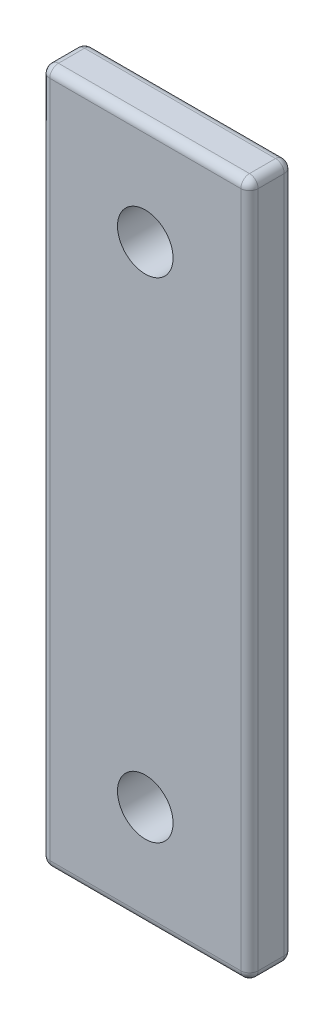
from build123d import *

# Parameters (mm, degrees)
SKETCH1_W           = 48
SKETCH1_H           = 160
BOSS_EXTRUDE1_DEPTH = 10
FILLET1_R           = 2
FILLET2_R           = 2
SKETCH2_R           = 6.4
CUT_EXTRUDE1_DEPTH  = 85.118963379


with BuildPart() as part:
    # Sketch1 → Boss-Extrude1 (new body)
    with BuildSketch(Plane.XY):
        Rectangle(SKETCH1_W, SKETCH1_H)
    extrude(amount=BOSS_EXTRUDE1_DEPTH)

    # Fillet1
    fillet1_edges = [part.edges().sort_by_distance(p)[0] for p in [
        (-24, 0, 10),
        (0, -80, 10),
        (24, 0, 10),
        (0, -80, 0),
        (-24, 0, 0),
        (0, 80, 0),
        (24, 0, 0),
        (0, 80, 10),
    ]]
    fillet(fillet1_edges, radius=FILLET1_R)

    # Fillet2
    # the kernel refuses this fillet: 2 mm, written as the material it takes off along each edge
    with BuildSketch(Plane(origin=(-22, 78, 8), x_dir=(0, 1, 0), z_dir=(-1, 0, 0))) as fillet2_piece_1_section:
        Polygon((0, 0), (FILLET2_R, 0), (FILLET2_R, -FILLET2_R), (0, -FILLET2_R), align=None)
    fillet2_piece_1 = extrude(amount=FILLET2_R, mode=Mode.PRIVATE)
    fillet2_piece_1 = fillet2_piece_1 - Plane(origin=(-22, 78, 8), x_dir=(0, -0.7071067811865475, -0.7071067811865475), z_dir=(-1, 0, 0)) * Sphere(FILLET2_R, mode=Mode.PRIVATE)
    add(fillet2_piece_1, mode=Mode.SUBTRACT)
    with BuildSketch(Plane(origin=(22, 78, 8), x_dir=(0, 1, 0), z_dir=(1, 0, 0))) as fillet2_piece_2_section:
        Polygon((0, 0), (FILLET2_R, 0), (FILLET2_R, FILLET2_R), (0, FILLET2_R), align=None)
    fillet2_piece_2 = extrude(amount=FILLET2_R, mode=Mode.PRIVATE)
    fillet2_piece_2 = fillet2_piece_2 - Plane(origin=(22, 78, 8), x_dir=(0, -0.7071067811865475, -0.7071067811865475), z_dir=(1, 0, 0)) * Sphere(FILLET2_R, mode=Mode.PRIVATE)
    add(fillet2_piece_2, mode=Mode.SUBTRACT)
    with BuildSketch(Plane(origin=(-22, -78, 8), x_dir=(-1, 0, 0), z_dir=(0, -1, 0))) as fillet2_piece_3_section:
        Polygon((0, 0), (FILLET2_R, 0), (FILLET2_R, -FILLET2_R), (0, -FILLET2_R), align=None)
    fillet2_piece_3 = extrude(amount=FILLET2_R, mode=Mode.PRIVATE)
    fillet2_piece_3 = fillet2_piece_3 - Plane(origin=(-22, -78, 8), x_dir=(0.7071067811865475, 0, -0.7071067811865475), z_dir=(0, -1, 0)) * Sphere(FILLET2_R, mode=Mode.PRIVATE)
    add(fillet2_piece_3, mode=Mode.SUBTRACT)
    with BuildSketch(Plane(origin=(22, -78, 8), x_dir=(1, 0, 0), z_dir=(0, -1, 0))) as fillet2_piece_4_section:
        Polygon((0, 0), (FILLET2_R, 0), (FILLET2_R, FILLET2_R), (0, FILLET2_R), align=None)
    fillet2_piece_4 = extrude(amount=FILLET2_R, mode=Mode.PRIVATE)
    fillet2_piece_4 = fillet2_piece_4 - Plane(origin=(22, -78, 8), x_dir=(-0.7071067811865475, 0, -0.7071067811865475), z_dir=(0, -1, 0)) * Sphere(FILLET2_R, mode=Mode.PRIVATE)
    add(fillet2_piece_4, mode=Mode.SUBTRACT)
    with BuildSketch(Plane(origin=(22, -78, 2), x_dir=(1, 0, 0), z_dir=(0, -1, 0))) as fillet2_piece_5_section:
        Polygon((0, 0), (FILLET2_R, 0), (FILLET2_R, -FILLET2_R), (0, -FILLET2_R), align=None)
    fillet2_piece_5 = extrude(amount=FILLET2_R, mode=Mode.PRIVATE)
    fillet2_piece_5 = fillet2_piece_5 - Plane(origin=(22, -78, 2), x_dir=(-0.7071067811865475, 0, 0.7071067811865475), z_dir=(0, -1, 0)) * Sphere(FILLET2_R, mode=Mode.PRIVATE)
    add(fillet2_piece_5, mode=Mode.SUBTRACT)
    with BuildSketch(Plane(origin=(-22, -78, 2), x_dir=(-1, 0, 0), z_dir=(0, -1, 0))) as fillet2_piece_6_section:
        Polygon((0, 0), (FILLET2_R, 0), (FILLET2_R, FILLET2_R), (0, FILLET2_R), align=None)
    fillet2_piece_6 = extrude(amount=FILLET2_R, mode=Mode.PRIVATE)
    fillet2_piece_6 = fillet2_piece_6 - Plane(origin=(-22, -78, 2), x_dir=(0.7071067811865475, 0, 0.7071067811865475), z_dir=(0, -1, 0)) * Sphere(FILLET2_R, mode=Mode.PRIVATE)
    add(fillet2_piece_6, mode=Mode.SUBTRACT)
    with BuildSketch(Plane(origin=(22, 78, 2), x_dir=(0, 1, 0), z_dir=(1, 0, 0))) as fillet2_piece_7_section:
        Polygon((0, 0), (FILLET2_R, 0), (FILLET2_R, -FILLET2_R), (0, -FILLET2_R), align=None)
    fillet2_piece_7 = extrude(amount=FILLET2_R, mode=Mode.PRIVATE)
    fillet2_piece_7 = fillet2_piece_7 - Plane(origin=(22, 78, 2), x_dir=(0, -0.7071067811865475, 0.7071067811865475), z_dir=(1, 0, 0)) * Sphere(FILLET2_R, mode=Mode.PRIVATE)
    add(fillet2_piece_7, mode=Mode.SUBTRACT)
    with BuildSketch(Plane(origin=(-22, 78, 2), x_dir=(0, 1, 0), z_dir=(-1, 0, 0))) as fillet2_piece_8_section:
        Polygon((0, 0), (FILLET2_R, 0), (FILLET2_R, FILLET2_R), (0, FILLET2_R), align=None)
    fillet2_piece_8 = extrude(amount=FILLET2_R, mode=Mode.PRIVATE)
    fillet2_piece_8 = fillet2_piece_8 - Plane(origin=(-22, 78, 2), x_dir=(0, -0.7071067811865475, 0.7071067811865475), z_dir=(-1, 0, 0)) * Sphere(FILLET2_R, mode=Mode.PRIVATE)
    add(fillet2_piece_8, mode=Mode.SUBTRACT)
    with BuildSketch(Plane(origin=(24, -80, 2), x_dir=(-1, 0, 0), z_dir=(0, 0, 1)), Plane(origin=(24, 80, 2), x_dir=(0, -1, 0), z_dir=(0, 0, 1))) as fillet2_piece_9:
        with BuildLine():
            CenterArc((FILLET2_R, -FILLET2_R), FILLET2_R, 90, 90)
            Line((0, -FILLET2_R), (0, 0))
            Line((0, 0), (FILLET2_R, 0))
        make_face()
    extrude(amount=6, mode=Mode.SUBTRACT)
    with BuildSketch(Plane(origin=(-24, -80, 2), x_dir=(1, 0, 0), z_dir=(0, 0, 1)), Plane(origin=(-24, 80, 2), x_dir=(0, -1, 0), z_dir=(0, 0, 1))) as fillet2_piece_10:
        with BuildLine():
            CenterArc((FILLET2_R, FILLET2_R), FILLET2_R, 180, 90)
            Line((0, FILLET2_R), (0, 0))
            Line((0, 0), (FILLET2_R, 0))
        make_face()
    extrude(amount=6, mode=Mode.SUBTRACT)

    # Sketch2 → Cut-Extrude1 (cut, through all)
    with BuildSketch(Plane(origin=(0, 0, 0), x_dir=(-1, 0, 0), z_dir=(0, 0, -1))):
        with Locations((0, 56.35)):
            Circle(SKETCH2_R)
    cut_extrude1 = extrude(amount=-CUT_EXTRUDE1_DEPTH, mode=Mode.SUBTRACT)

    # Mirror2: Cut-Extrude1 across plane
    add(cut_extrude1.mirror(Plane.ZX), mode=Mode.SUBTRACT)


solid = part.part
